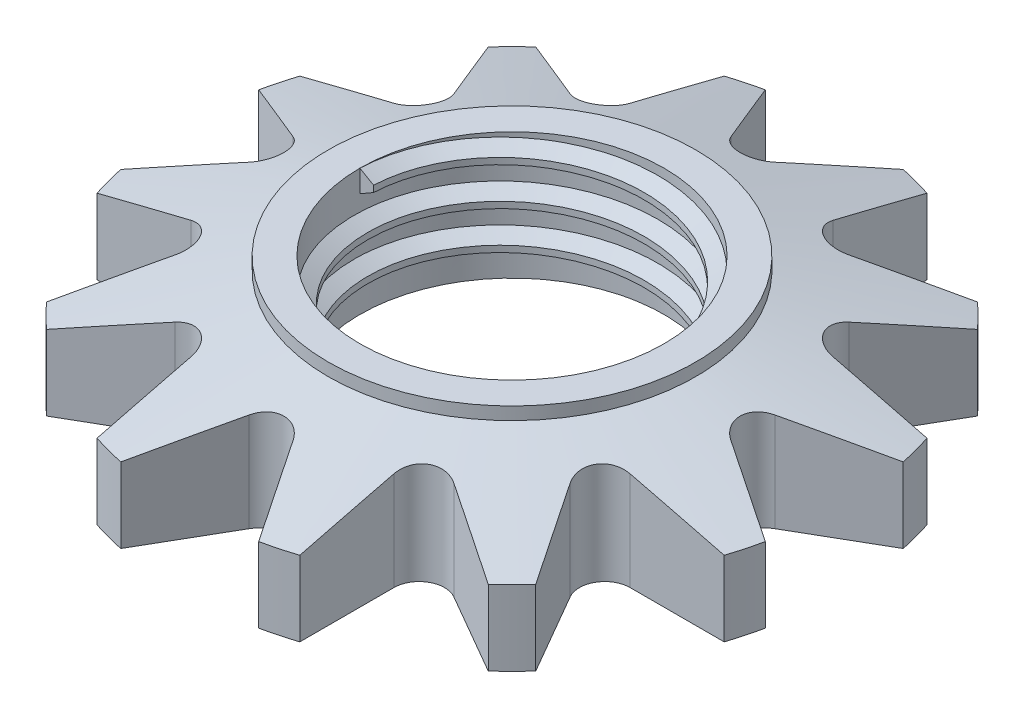
from build123d import *

# Parameters (mm, degrees)
SKETCH1_R           = 26
SKETCH1_R_2         = 12
BOSS_EXTRUDE1_DEPTH = 9
SKETCH2_R           = 14.5
SKETCH2_R_2         = 12
BOSS_EXTRUDE2_DEPTH = 1
CUT_EXTRUDE1_DEPTH  = 38.854986461
THREAD1_PITCH       = 3


with BuildPart() as part:
    # Sketch1 → Boss-Extrude1 (new body)
    with BuildSketch(Plane(origin=(0, 0, 0), x_dir=(1, 0, 0), z_dir=(0, 1, 0))):
        with Locations(Location((0, 0, 0), (0, 0, 270))):
            Circle(SKETCH1_R)
        with Locations(Location((0, 0, 0), (0, 0, 270))):
            Circle(SKETCH1_R_2, mode=Mode.SUBTRACT)
    extrude(amount=BOSS_EXTRUDE1_DEPTH)

    # Sketch2 → Boss-Extrude2 (add)
    with BuildSketch(Plane(origin=(0, 9, 0), x_dir=(1, 0, 0), z_dir=(0, 1, 0))):
        with Locations(Location((0, 0, 0), (0, 0, 270))):
            Circle(SKETCH2_R)
        with Locations(Location((0, 0, 0), (0, 0, 270))):
            Circle(SKETCH2_R_2, mode=Mode.SUBTRACT)
    extrude(amount=BOSS_EXTRUDE2_DEPTH)

    # Sketch3 → Cut-Extrude1 (cut, through all)
    with BuildSketch(Plane(origin=(0, 9, 0), x_dir=(1, 0, 0), z_dir=(0, 1, 0))):
        with BuildLine():
            Line((-5.441113647, 25.424285286), (-1.732050808, 19))
            ThreePointArc((-1.732050808, 19), (0, 18), (1.732050808, 19))
            Line((1.732050808, 19), (5.441113647, 25.424285286))
            ThreePointArc((5.441113647, 25.424285286), (0, 26), (-5.441113647, 25.424285286))
        make_face()
        with BuildLine():
            Line((8, 24.738633754), (8, 17.320508076))
            ThreePointArc((8, 17.320508076), (9, 15.588457268), (11, 15.588457268))
            Line((11, 15.588457268), (17.424285286, 19.297520107))
            ThreePointArc((17.424285286, 19.297520107), (13, 22.516660498), (8, 24.738633754))
        make_face()
        with BuildLine():
            Line((19.297520107, 17.424285286), (15.588457268, 11))
            ThreePointArc((15.588457268, 11), (15.588457268, 9), (17.320508076, 8))
            Line((17.320508076, 8), (24.738633754, 8))
            ThreePointArc((24.738633754, 8), (22.516660498, 13), (19.297520107, 17.424285286))
        make_face()
        with BuildLine():
            Line((25.424285286, 5.441113647), (19, 1.732050808))
            ThreePointArc((19, 1.732050808), (18, 0), (19, -1.732050808))
            Line((19, -1.732050808), (25.424285286, -5.441113647))
            ThreePointArc((25.424285286, -5.441113647), (26, 0), (25.424285286, 5.441113647))
        make_face()
        with BuildLine():
            Line((24.738633754, -8), (17.320508076, -8))
            ThreePointArc((17.320508076, -8), (15.588457268, -9), (15.588457268, -11))
            Line((15.588457268, -11), (19.297520107, -17.424285286))
            ThreePointArc((19.297520107, -17.424285286), (22.516660498, -13), (24.738633754, -8))
        make_face()
        with BuildLine():
            Line((17.424285286, -19.297520107), (11, -15.588457268))
            ThreePointArc((11, -15.588457268), (9, -15.588457268), (8, -17.320508076))
            Line((8, -17.320508076), (8, -24.738633754))
            ThreePointArc((8, -24.738633754), (13, -22.516660498), (17.424285286, -19.297520107))
        make_face()
        with BuildLine():
            Line((5.441113647, -25.424285286), (1.732050808, -19))
            ThreePointArc((1.732050808, -19), (0, -18), (-1.732050808, -19))
            Line((-1.732050808, -19), (-5.441113647, -25.424285286))
            ThreePointArc((-5.441113647, -25.424285286), (0, -26), (5.441113647, -25.424285286))
        make_face()
        with BuildLine():
            Line((-8, -24.738633754), (-8, -17.320508076))
            ThreePointArc((-8, -17.320508076), (-9, -15.588457268), (-11, -15.588457268))
            Line((-11, -15.588457268), (-17.424285286, -19.297520107))
            ThreePointArc((-17.424285286, -19.297520107), (-13, -22.516660498), (-8, -24.738633754))
        make_face()
        with BuildLine():
            Line((-19.297520107, -17.424285286), (-15.588457268, -11))
            ThreePointArc((-15.588457268, -11), (-15.588457268, -9), (-17.320508076, -8))
            Line((-17.320508076, -8), (-24.738633754, -8))
            ThreePointArc((-24.738633754, -8), (-22.516660498, -13), (-19.297520107, -17.424285286))
        make_face()
        with BuildLine():
            Line((-25.424285286, -5.441113647), (-19, -1.732050808))
            ThreePointArc((-19, -1.732050808), (-18, 0), (-19, 1.732050808))
            Line((-19, 1.732050808), (-25.424285286, 5.441113647))
            ThreePointArc((-25.424285286, 5.441113647), (-26, 0), (-25.424285286, -5.441113647))
        make_face()
        with BuildLine():
            Line((-24.738633754, 8), (-17.320508076, 8))
            ThreePointArc((-17.320508076, 8), (-15.588457268, 9), (-15.588457268, 11))
            Line((-15.588457268, 11), (-19.297520107, 17.424285286))
            ThreePointArc((-19.297520107, 17.424285286), (-22.516660498, 13), (-24.738633754, 8))
        make_face()
        with BuildLine():
            Line((-17.424285286, 19.297520107), (-11, 15.588457268))
            ThreePointArc((-11, 15.588457268), (-9, 15.588457268), (-8, 17.320508076))
            Line((-8, 17.320508076), (-8, 24.738633754))
            ThreePointArc((-8, 24.738633754), (-13, 22.516660498), (-17.424285286, 19.297520107))
        make_face()
    extrude(amount=-CUT_EXTRUDE1_DEPTH, mode=Mode.SUBTRACT)

    # Sketch4 → Cut-Revolve1 (revolve, cut)
    with BuildSketch(Plane.XY, mode=Mode.PRIVATE) as cut_revolve1_sk:
        Polygon((14.5, 9), (26.90714535, 5.675515423), (26.90714535, 9), align=None)
    revolve(cut_revolve1_sk.sketch.rotate(Axis((0, 0, 0), (0, 1, 0)), 90), axis=Axis((0, 0, 0), (0, 1, 0)), mode=Mode.SUBTRACT)

    # Thread1: the profile of Thread Profile1 profile screwed along a right-hand helix of 2.8 turns, 10 arcs to a turn; built about Z, then put on its axis
    thread1_z = Axis((0, 0, 0), (0, 0, 1))
    thread1_corners = [(12.0003, 0, -0.000173205), (12.0003, 0, 1.7501732), (10.91746825, 0, 1.124999997), (10.91746825, 0, 0.624999997)]
    with BuildLine(mode=Mode.PRIVATE) as thread1_profile:
        Line(thread1_corners[0], thread1_corners[1])
        Line(thread1_corners[1], thread1_corners[2])
        Line(thread1_corners[2], thread1_corners[3])
        Line(thread1_corners[3], thread1_corners[0])
    thread1_cap = Face(thread1_profile.wire())
    thread1_turn_angles = [0, 18, 36, 54, 72, 90, 108, 126, 144, 162, 180, 198, 216, 234, 252, 270, 288, 306, 324, 342, 360]
    thread1_turn_weights = [1, 0.9510565162951535, 1, 0.9510565162951535, 1, 0.9510565162951535, 1, 0.9510565162951535, 1, 0.9510565162951535, 1, 0.9510565162951535, 1, 0.9510565162951535, 1, 0.9510565162951535, 1, 0.9510565162951535, 1, 0.9510565162951535, 1]
    thread1_turn_rails = [Edge.make_bspline([Vector(p[0], p[1], 0).rotate(thread1_z, thread1_turn_angles[k]) / thread1_turn_weights[k] + Vector(0, 0, p[2] + THREAD1_PITCH * thread1_turn_angles[k] / 360) for k in range(21)], [0, 0, 0, 1, 1, 2, 2, 3, 3, 4, 4, 5, 5, 6, 6, 7, 7, 8, 8, 9, 9, 10, 10, 10], 2, thread1_turn_weights) for p in thread1_corners]
    thread1_turn_sides = [Face.make_surface_from_curves(thread1_turn_rails[p[0]], thread1_turn_rails[p[1]]) for p in [(0, 1), (1, 2), (2, 3), (3, 0)]]
    thread1_last_angles = [720, 738, 756, 774, 792, 810, 828, 846, 864, 882, 900, 918, 936, 954, 972, 990, 1008]
    thread1_last_weights = [1, 0.9510565162951535, 1, 0.9510565162951535, 1, 0.9510565162951535, 1, 0.9510565162951535, 1, 0.9510565162951535, 1, 0.9510565162951535, 1, 0.9510565162951535, 1, 0.9510565162951535, 1]
    thread1_last_rails = [Edge.make_bspline([Vector(p[0], p[1], 0).rotate(thread1_z, thread1_last_angles[k]) / thread1_last_weights[k] + Vector(0, 0, p[2] + THREAD1_PITCH * thread1_last_angles[k] / 360) for k in range(17)], [0, 0, 0, 1, 1, 2, 2, 3, 3, 4, 4, 5, 5, 6, 6, 7, 7, 8, 8, 8], 2, thread1_last_weights) for p in thread1_corners]
    thread1_last_sides = [Face.make_surface_from_curves(thread1_last_rails[p[0]], thread1_last_rails[p[1]]) for p in [(0, 1), (1, 2), (2, 3), (3, 0)]]
    thread1 = Plane(origin=(0, 10, 0), x_dir=(-1, 0, 0), z_dir=(0, -1, 0)) * Solid(Shell([*[p.moved(Location((0, 0, THREAD1_PITCH * i))) for i in range(2) for p in thread1_turn_sides], *thread1_last_sides, thread1_cap, thread1_cap.rotate(thread1_z, 1008).moved(Location((0, 0, THREAD1_PITCH * 1008 / 360)))]))
    add(thread1)


solid = part.part
